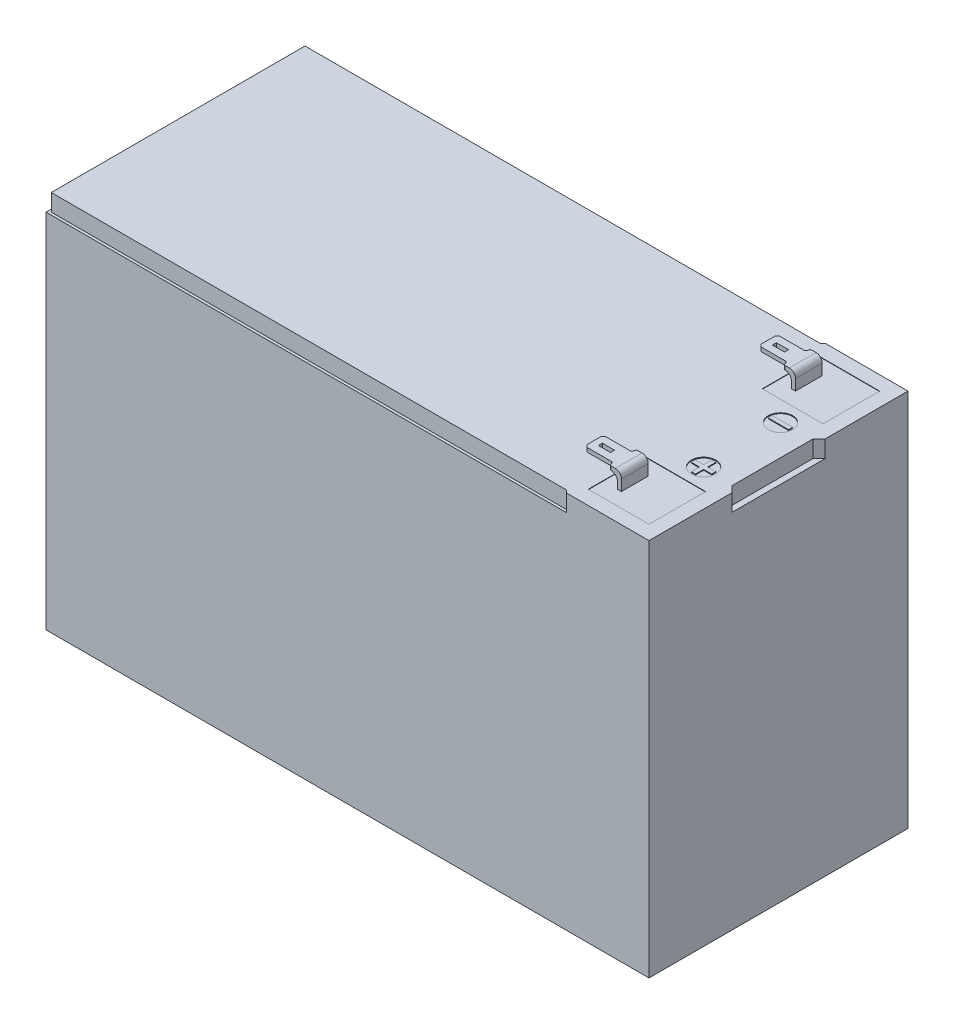
from build123d import *

# Parameters (mm, degrees)
SKETCH1_W            = 149
SKETCH1_H            = 64
BOSS_EXTRUDE1_DEPTH  = 93.6
SKETCH2_W            = 1.5
SKETCH2_H            = 20
CUT_EXTRUDE1_DEPTH   = 4.2
SKETCH2_3_W          = 15
SKETCH2_3_H          = 14
CUT_EXTRUDE2_DEPTH   = 0.1
SKETCH2_4_R          = 3
SKETCH2_4_W          = 5
SKETCH2_4_H          = 1
CUT_EXTRUDE3_DEPTH   = 0.2
SKETCH3_W            = 1
SKETCH3_H            = 6.6
BOSS_EXTRUDE2_DEPTH  = 4.2
SKETCH4_W            = 6.6
SKETCH4_H            = 1
BOSS_EXTRUDE3_DEPTH  = 9.1
CUT_EXTRUDE4_REACH   = 128.963
SKETCH5_W            = 3
SKETCH5_H            = 1
FILLET1_START        = 93.5
FILLET1_DEPTH        = 5.5
FILLET1_START_2      = 96.7
FILLET1_2_DEPTH      = 1
FILLET2_R            = 1.5
FILLET2_OF_MIRROR1_R = 1.5


with BuildPart() as part:
    # Sketch1 → Boss-Extrude1 (new body)
    with BuildSketch(Plane(origin=(0, 0, 0), x_dir=(1, 0, 0), z_dir=(0, 1, 0))):
        Rectangle(SKETCH1_W, SKETCH1_H)
    extrude(amount=BOSS_EXTRUDE1_DEPTH)

    # Sketch2 → Cut-Extrude1 (cut)
    with BuildSketch(Plane(origin=(0, 93.6, 0), x_dir=(1, 0, 0), z_dir=(0, 1, 0))):
        with Locations((73.75, 0)):
            Rectangle(SKETCH2_W, SKETCH2_H)
        Polygon((74.5, 10), (74.5, 11.5), (73, 10), align=None)
        Polygon((73, -10), (74.5, -11.5), (74.5, -10), align=None)
        Polygon((54.15, -32), (53.5, -31.35), (-73.85, -31.35), (-73.85, 31.35), (53.5, 31.35), (54.15, 32), (-74.5, 32), (-74.5, -32), align=None)
    extrude(amount=-CUT_EXTRUDE1_DEPTH, mode=Mode.SUBTRACT)

    # Sketch2<3> → Cut-Extrude2 (cut)
    with BuildSketch(Plane(origin=(0, 93.6, 0), x_dir=(1, 0, 0), z_dir=(0, 1, 0))):
        with Locations((63.5, 21.5)):
            Rectangle(SKETCH2_3_W, SKETCH2_3_H)
        with Locations((63.5, -21.5)):
            Rectangle(SKETCH2_3_W, SKETCH2_3_H)
    extrude(amount=-CUT_EXTRUDE2_DEPTH, mode=Mode.SUBTRACT)

    # Sketch2<4> → Cut-Extrude3 (cut)
    # profile 1 of 2: a face of its own
    with BuildSketch(Plane(origin=(0, 93.6, 0), x_dir=(1, 0, 0), z_dir=(0, 1, 0))):
        with Locations(Location((65.5, 9.5, 0), (0, 0, 270))):
            Circle(SKETCH2_4_R)
        with Locations((65.5, 9.5)):
            Rectangle(SKETCH2_4_W, SKETCH2_4_H, mode=Mode.SUBTRACT)
    # profile 2 of 2: a face of its own
    with BuildSketch(Plane(origin=(0, 93.6, 0), x_dir=(1, 0, 0), z_dir=(0, 1, 0))):
        with Locations(Location((65.5, -9.5, 0), (0, 0, 270))):
            Circle(SKETCH2_4_R)
        Polygon((68, -9), (68, -10), (66, -10), (66, -12), (65, -12), (65, -10), (63, -10), (63, -9), (65, -9), (65, -7), (66, -7), (66, -9), align=None, mode=Mode.SUBTRACT)
    extrude(amount=-CUT_EXTRUDE3_DEPTH, mode=Mode.SUBTRACT)

    # Sketch3 → Boss-Extrude2 (add)
    with BuildSketch(Plane(origin=(0, 93.5, 0), x_dir=(1, 0, 0), z_dir=(0, 1, 0))):
        with Locations((60, 21.5)):
            Rectangle(SKETCH3_W, SKETCH3_H)
    boss_extrude2 = extrude(amount=BOSS_EXTRUDE2_DEPTH)

    # Sketch4 → Boss-Extrude3 (add)
    with BuildSketch(Plane.ZY.offset(-59.5)):
        with Locations((-21.5, 97.2)):
            Rectangle(SKETCH4_W, SKETCH4_H)
    boss_extrude3 = extrude(amount=BOSS_EXTRUDE3_DEPTH)

    # Sketch5 → Cut-Extrude4 (cut, up to next)
    with BuildSketch(Plane(origin=(0, 97.7, 0), x_dir=(1, 0, 0), z_dir=(0, 1, 0)), mode=Mode.PRIVATE) as cut_extrude4_sk1:
        Polygon((57.5, 23.8), (57.5, 24.8), (49.983191487, 24.8), (49.983191487, 22.8), (50.983191487, 23.8), align=None)
    cut_extrude4_tool1 = extrude(cut_extrude4_sk1.sketch, amount=-CUT_EXTRUDE4_REACH, mode=Mode.PRIVATE) & part.part
    # Sketch5 → Cut-Extrude4 (cut, up to next)
    with BuildSketch(Plane(origin=(0, 97.7, 0), x_dir=(1, 0, 0), z_dir=(0, 1, 0)), mode=Mode.PRIVATE) as cut_extrude4_sk2:
        Polygon((57.5, 18.2), (57.5, 19.2), (50.983191487, 19.2), (49.983191487, 20.2), (49.983191487, 18.2), align=None)
    cut_extrude4_tool2 = extrude(cut_extrude4_sk2.sketch, amount=-CUT_EXTRUDE4_REACH, mode=Mode.PRIVATE) & part.part
    # Sketch5 → Cut-Extrude4 (cut, up to next)
    with BuildSketch(Plane(origin=(0, 97.7, 0), x_dir=(1, 0, 0), z_dir=(0, 1, 0)), mode=Mode.PRIVATE) as cut_extrude4_sk3:
        with Locations((53.483191487, 21.5)):
            Rectangle(SKETCH5_W, SKETCH5_H)
    cut_extrude4_tool3 = extrude(cut_extrude4_sk3.sketch, amount=-CUT_EXTRUDE4_REACH, mode=Mode.PRIVATE) & part.part
    cut_extrude4_1 = cut_extrude4_tool1.solids().sort_by_distance((53.527978, 97.7, -24.248026))[0]
    add(cut_extrude4_1, mode=Mode.SUBTRACT)
    cut_extrude4_2 = cut_extrude4_tool2.solids().sort_by_distance((53.527978, 97.7, -18.751974))[0]
    add(cut_extrude4_2, mode=Mode.SUBTRACT)
    cut_extrude4_3 = cut_extrude4_tool3.solids().sort_by_distance((53.483191, 97.7, -21.5))[0]
    add(cut_extrude4_3, mode=Mode.SUBTRACT)
    cut_extrude4 = cut_extrude4_1 + cut_extrude4_2 + cut_extrude4_3  # Cut-Extrude4 as one shape, for the pattern or mirror that repeats it

    # Fillet1: read off the stored shape, not the designer's step
    # Fillet1 outline → Fillet1 (cut)
    with BuildSketch(Plane(origin=(0, 0, 0), x_dir=(1, 0, 0), z_dir=(0, 1, 0)).offset(FILLET1_START)):
        with BuildLine():
            ThreePointArc((58, 18.2), (57.646446609, 18.346446609), (57.5, 18.7))
            Line((57.5, 18.7), (57.5, 18.2))
            Line((57.5, 18.2), (58, 18.2))
        make_face()
        with BuildLine():
            Line((57.5, 24.8), (57.5, 24.3))
            ThreePointArc((57.5, 24.3), (57.646446609, 24.653553391), (58, 24.8))
            Line((58, 24.8), (57.5, 24.8))
        make_face()
    fillet1 = extrude(amount=FILLET1_DEPTH, mode=Mode.SUBTRACT)

    # Fillet1 2 outline → Fillet1 2 (add)
    with BuildSketch(Plane(origin=(0, 0, 0), x_dir=(1, 0, 0), z_dir=(0, 1, 0)).offset(FILLET1_START_2)):
        with BuildLine():
            ThreePointArc((57, 19.2), (57.353553391, 19.053553391), (57.5, 18.7))
            Line((57.5, 18.7), (57.5, 19.2))
            Line((57.5, 19.2), (57, 19.2))
        make_face()
        with BuildLine():
            Line((57.5, 23.8), (57.5, 24.3))
            ThreePointArc((57.5, 24.3), (57.353553391, 23.946446609), (57, 23.8))
            Line((57, 23.8), (57.5, 23.8))
        make_face()
    fillet1_2 = extrude(amount=FILLET1_2_DEPTH)

    # Fillet2
    fillet2_edges = [part.edges().sort_by_distance(p)[0] for p in [
        (59.5, 96.7, -21.5),
        (60.5, 97.7, -21.5),
    ]]
    fillet(fillet2_edges, radius=FILLET2_R)

    # Mirror1: Boss-Extrude2, Boss-Extrude3, Cut-Extrude4, Fillet1, Fillet1 2 across plane
    add(boss_extrude2.mirror(Plane.XY))
    add(boss_extrude3.mirror(Plane.XY))
    add(cut_extrude4.mirror(Plane.XY), mode=Mode.SUBTRACT)
    add(fillet1.mirror(Plane.XY), mode=Mode.SUBTRACT)
    add(fillet1_2.mirror(Plane.XY))

    # Fillet2 of Mirror1
    fillet2_of_mirror1_edges = [part.edges().sort_by_distance(p)[0] for p in [
        (59.5, 96.7, 21.5),
        (60.5, 97.7, 21.5),
    ]]
    fillet(fillet2_of_mirror1_edges, radius=FILLET2_OF_MIRROR1_R)


solid = part.part
